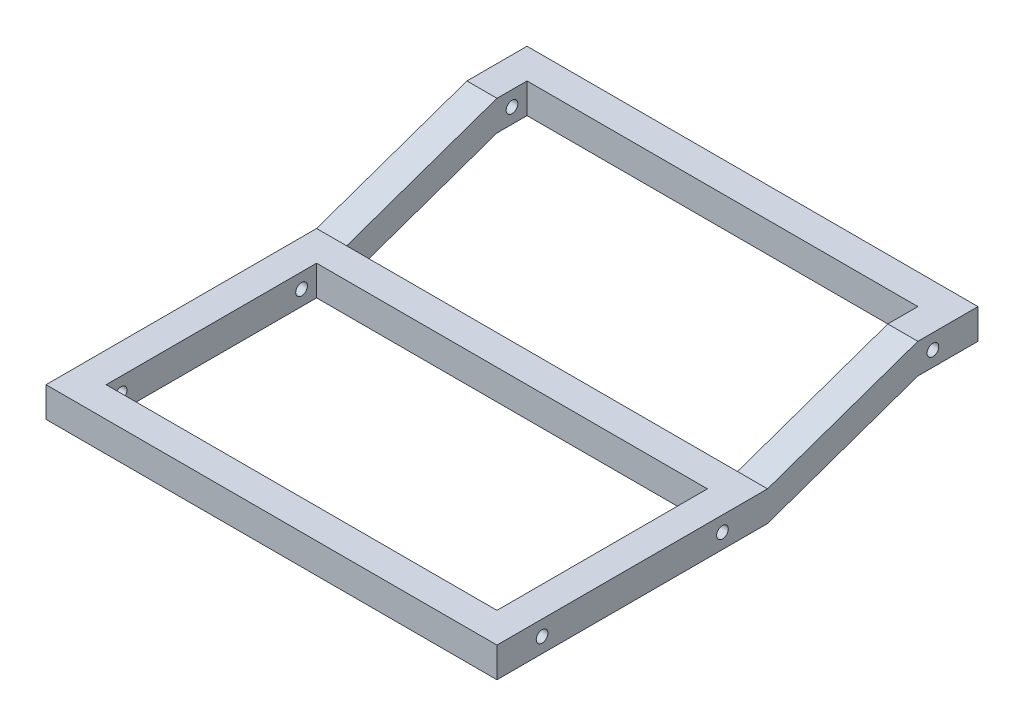
from build123d import *

# Parameters (mm, degrees)
BOSS_EXTRUDE1_OUTLINE_W   = 120
BOSS_EXTRUDE1_OUTLINE_H   = 72
BOSS_EXTRUDE1_OUTLINE_W_2 = 104
BOSS_EXTRUDE1_OUTLINE_H_2 = 56
BOSS_EXTRUDE1_DEPTH       = 8
SKETCH3_W                 = 16
SKETCH3_H                 = 8
BOSS_EXTRUDE2_DEPTH       = 8
SKETCH4_W                 = 8
SKETCH4_H                 = 8
BOSS_EXTRUDE3_DEPTH       = 110
SKETCH5_W                 = 16
SKETCH5_H                 = 8
BOSS_EXTRUDE4_DEPTH       = 8
SKETCH6_R                 = 1.55
CUT_EXTRUDE1_DEPTH        = 211


# Read off the part's stored shape, not the designer's step: Boss-Extrude1
with BuildPart() as part:
    # Boss-Extrude1 outline → Boss-Extrude1 (new body)
    with BuildSketch(Plane(origin=(0, 0, 0), x_dir=(1, 0, 0), z_dir=(0, 1, 0))):
        with Locations((49.44492245, 21.253637361)):
            Rectangle(BOSS_EXTRUDE1_OUTLINE_W, BOSS_EXTRUDE1_OUTLINE_H)
        with Locations((49.44492245, 21.253637361)):
            Rectangle(BOSS_EXTRUDE1_OUTLINE_W_2, BOSS_EXTRUDE1_OUTLINE_H_2, mode=Mode.SUBTRACT)
    extrude(amount=BOSS_EXTRUDE1_DEPTH)

    # Sketch3 → Boss-Extrude2 (add)
    with BuildSketch(Plane.ZY.offset(10.55507755)):
        Polygon((-97.253637361, 14), (-97.253637361, 22), (-57.253637361, 8), (-57.253637361, 0), align=None)
        with Locations((-105.253637361, 18)):
            Rectangle(SKETCH3_W, SKETCH3_H)
    extrude(amount=-BOSS_EXTRUDE2_DEPTH)

    # Sketch4 → Boss-Extrude3 (add)
    with BuildSketch(Plane(origin=(-2.55507755, 0, 0), x_dir=(0, 0, -1), z_dir=(1, 0, 0))):
        with Locations((109.253637361, 18)):
            Rectangle(SKETCH4_W, SKETCH4_H)
    extrude(amount=BOSS_EXTRUDE3_DEPTH)

    # Sketch5 → Boss-Extrude4 (add)
    with BuildSketch(Plane(origin=(109.44492245, 0, 0), x_dir=(0, 0, -1), z_dir=(1, 0, 0))):
        Polygon((57.253637361, 0), (97.253637361, 14), (97.253637361, 22), (57.253637361, 8), align=None)
        with Locations((105.253637361, 18)):
            Rectangle(SKETCH5_W, SKETCH5_H)
    extrude(amount=-BOSS_EXTRUDE4_DEPTH)

    # Sketch6 → Cut-Extrude1 (cut)
    with BuildSketch(Plane.ZY.offset(10.55507755)):
        with Locations((2.746362639, 4)):
            Circle(SKETCH6_R)
        with Locations((-45.253637361, 4)):
            Circle(SKETCH6_R)
        with Locations((-101.253637361, 18)):
            Circle(SKETCH6_R)
    extrude(amount=-CUT_EXTRUDE1_DEPTH, mode=Mode.SUBTRACT)


solid = part.part
